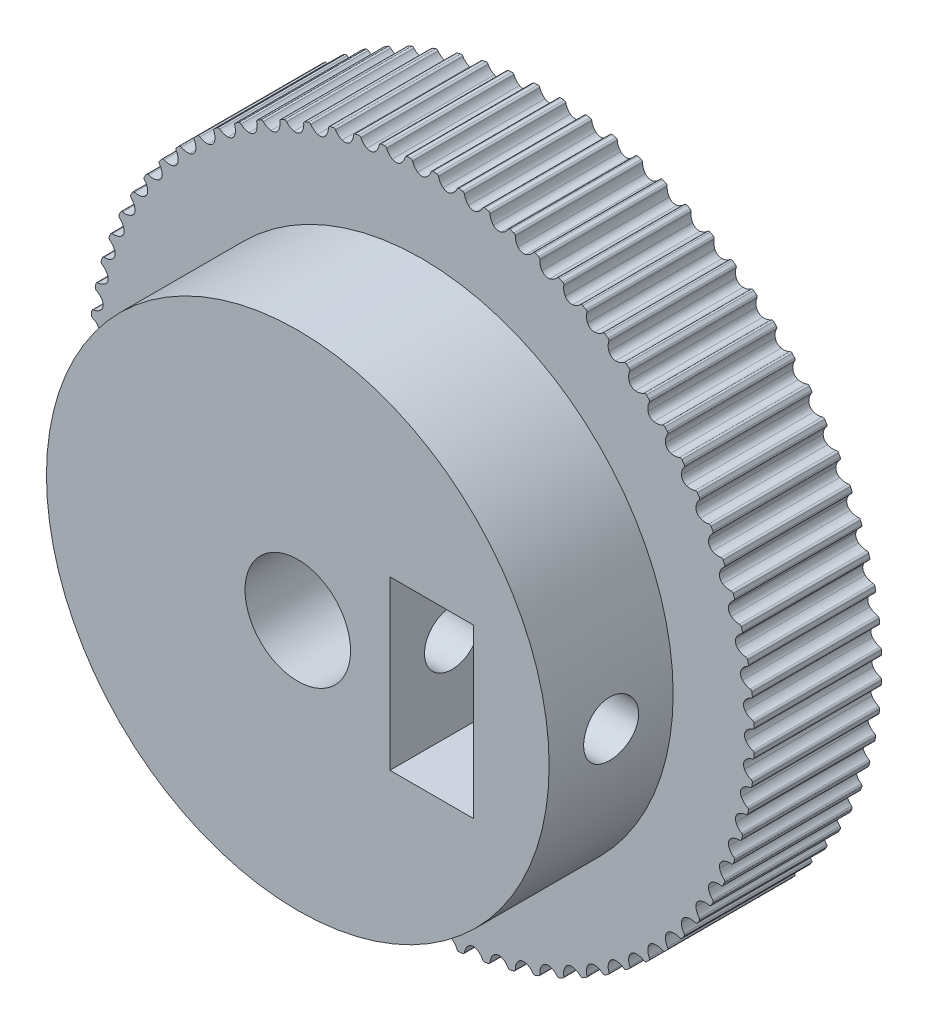
from build123d import *

# Parameters (mm, degrees)
CUT_EXTRUDE1_START = 0.125
CUT_EXTRUDE1_DEPTH = 38.027078607
CIRPATTERN1_COUNT  = 80
SKETCH4_R          = 2.0828
CUT_EXTRUDE2_DEPTH = 37.88255206
SKETCH6_W          = 6.35
SKETCH6_H          = 12.7
CUT_EXTRUDE3_DEPTH = 12.7


with BuildPart() as part:
    # Sketch2 → Revolve1 (revolve)
    with BuildSketch(Plane(origin=(0, 0, 0), x_dir=(0, 0, -1), z_dir=(1, 0, 0)), mode=Mode.PRIVATE) as revolve1_sk:
        Polygon((-9.525, 4), (9.525, 4), (9.525, 25.2095), (-0.125, 25.2095), (-0.125, 19.05), (-9.525, 19.05), align=None)
    revolve(revolve1_sk.sketch.rotate(Axis((0, 0, 9.525), (0, 0, -1)), 90), axis=Axis((0, 0, 9.525), (0, 0, -1)))

    # Sketch3 → Cut-Extrude1 (cut, through all)
    with BuildSketch(Plane.XY.offset(CUT_EXTRUDE1_START)):
        with BuildLine():
            Line((1.998425863, 25.130164829), (2.047001303, 25.741))
            Line((2.047001303, 25.741), (-2.047001303, 25.741))
            Line((-2.047001303, 25.741), (-1.998425863, 25.130164829))
            ThreePointArc((-1.998425863, 25.130164829), (-1.425226771, 25.169179941), (-0.851287437, 25.195122543))
            ThreePointArc((-0.851287437, 25.195122543), (-0.758961833, 25.167214793), (-0.702714921, 25.088862101))
            ThreePointArc((-0.702714921, 25.088862101), (-0.554430072, 24.791296599), (-0.316786517, 24.558790331))
            ThreePointArc((-0.316786517, 24.558790331), (0, 24.4595), (0.316786517, 24.558790331))
            ThreePointArc((0.316786517, 24.558790331), (0.554430072, 24.791296599), (0.702714921, 25.088862101))
            ThreePointArc((0.702714921, 25.088862101), (0.758961833, 25.167214793), (0.851287437, 25.195122543))
            ThreePointArc((0.851287437, 25.195122543), (1.425226771, 25.169179941), (1.998425863, 25.130164829))
        make_face()
    cut_extrude1 = extrude(amount=-CUT_EXTRUDE1_DEPTH, mode=Mode.SUBTRACT)

    # CirPattern1: Cut-Extrude1 ×80 about axis
    cirpattern1_axis = Axis((0, 0, 0), (0, 0, 1))
    for i in range(1, CIRPATTERN1_COUNT):
        add(cut_extrude1.rotate(cirpattern1_axis, i * 360 / CIRPATTERN1_COUNT), mode=Mode.SUBTRACT)

    # Sketch4 → Cut-Extrude2 (cut, through all)
    with BuildSketch(Plane(origin=(0, 0, 0), x_dir=(0, 0, -1), z_dir=(1, 0, 0))):
        with Locations(Location((-4.825, 0, 0), (0, 0, 180.000000004))):
            Circle(SKETCH4_R)
    extrude(amount=CUT_EXTRUDE2_DEPTH, mode=Mode.SUBTRACT)

    # Sketch6 → Cut-Extrude3 (cut)
    with BuildSketch(Plane.XY.offset(9.525)):
        with Locations((10.16, 0)):
            Rectangle(SKETCH6_W, SKETCH6_H)
    extrude(amount=-CUT_EXTRUDE3_DEPTH, mode=Mode.SUBTRACT)


solid = part.part
